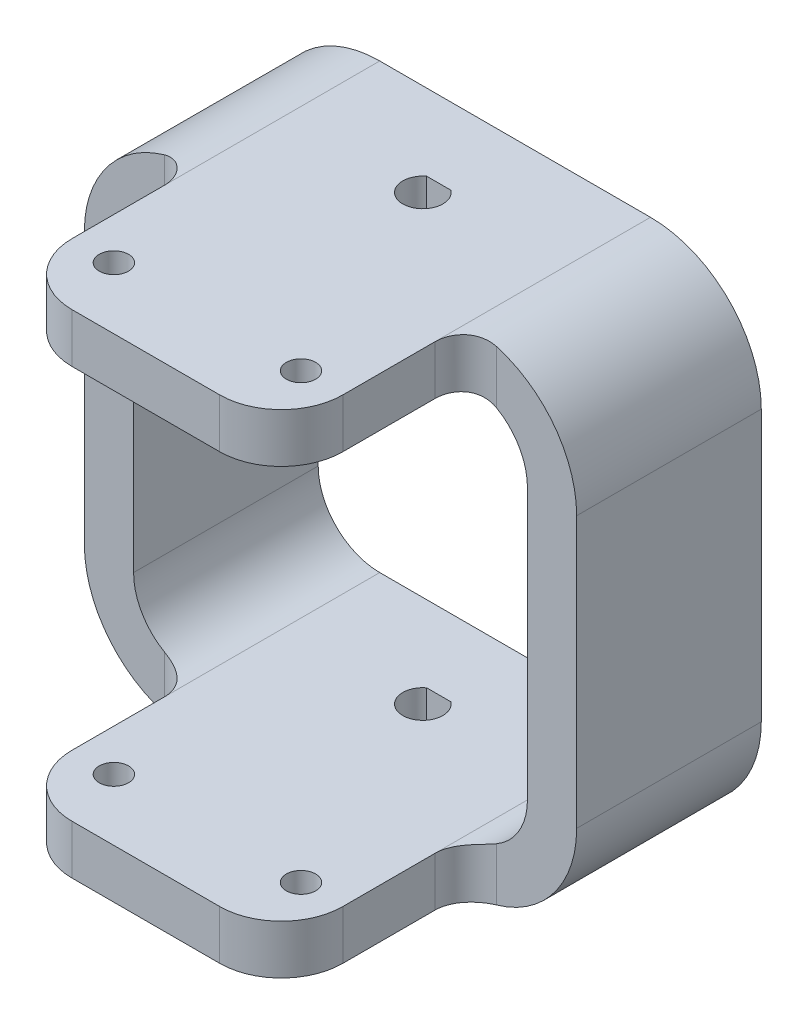
from build123d import *

# Parameters (mm, degrees)
ESQUISSE1_W                             = 80
ESQUISSE1_H                             = 80
ESQUISSE1_W_2                           = 64
ESQUISSE1_H_2                           = 64
BOSS_EXTRU_1_DEPTH                      = 15
CONG_2_R                                = 18
CONG_3_R                                = 10
ESQUISSE7_W                             = 44
ESQUISSE7_H                             = 8
BOSS_EXTRU_4_DEPTH                      = 30
PER_AGE_POUR_CROUS_AUTO_BLOQUANTS_300_D = 4.7625
CONG_1_R                                = 10
CONG_1_OF_SYM_TRIE2_R                   = 10
CONG_4_R                                = 5
ENL_V_MAT_EXTRU_3_DEPTH                 = 124.38962689


with BuildPart() as part:
    # Esquisse1 → Boss.-Extru.1 (new, symmetric)
    with BuildSketch(Plane.XY):
        Rectangle(ESQUISSE1_W, ESQUISSE1_H)
        Rectangle(ESQUISSE1_W_2, ESQUISSE1_H_2, mode=Mode.SUBTRACT)
    extrude(amount=BOSS_EXTRU_1_DEPTH, both=True)

    # Congé2
    cong_2_edges = [part.edges().sort_by_distance(p)[0] for p in [
        (-40, 40, 0),
        (40, 40, 0),
        (40, -40, 0),
        (-40, -40, 0),
    ]]
    fillet(cong_2_edges, radius=CONG_2_R)

    # Congé3
    cong_3_edges = [part.edges().sort_by_distance(p)[0] for p in [
        (32, -32, 0),
        (32, 32, 0),
        (-32, 32, 0),
        (-32, -32, 0),
    ]]
    fillet(cong_3_edges, radius=CONG_3_R)

    # Esquisse7 → Boss.-Extru.4 (add)
    with BuildSketch(Plane.XY.offset(15)):
        with Locations((0, 36)):
            Rectangle(ESQUISSE7_W, ESQUISSE7_H)
    boss_extru_4 = extrude(amount=BOSS_EXTRU_4_DEPTH)

    # Perçage pour écrous auto-bloquants 300® #6 (SP)1 (through all)
    with Locations(Plane(origin=(0, 40, 0), x_dir=(0, 0, -1), z_dir=(0, 1, 0))):
        with Locations((-35, -15.205), (-35, 15.205)):
            per_age_pour_crous_auto_bloquants_300 = Hole(PER_AGE_POUR_CROUS_AUTO_BLOQUANTS_300_D / 2)

    # Congé1
    cong_1_edges = [part.edges().sort_by_distance(p)[0] for p in [
        (22, 36, 45),
        (-22, 36, 45),
    ]]
    fillet(cong_1_edges, radius=CONG_1_R)

    # Symétrie2: Boss.-Extru.4, Perçage pour écrous auto-bloquants 300® #6 (SP)1 across plane
    add(boss_extru_4.mirror(Plane.ZX))
    add(per_age_pour_crous_auto_bloquants_300.mirror(Plane.ZX), mode=Mode.SUBTRACT)

    # Congé1 of Symétrie2
    cong_1_of_sym_trie2_edges = [part.edges().sort_by_distance(p)[0] for p in [
        (22, -36, 45),
        (-22, -36, 45),
    ]]
    fillet(cong_1_of_sym_trie2_edges, radius=CONG_1_OF_SYM_TRIE2_R)

    # Congé4
    # the kernel refuses this fillet: 5 mm, written as the material it adds along each edge
    with BuildSketch(Plane(origin=(22, -52.5, 15), x_dir=(0, 0, 1), z_dir=(0, 1, 0))) as cong_4_piece_1_section:
        with BuildLine():
            CenterArc((CONG_4_R, CONG_4_R), CONG_4_R, 180, 90)
            Line((0, CONG_4_R), (0, 0))
            Line((0, 0), (CONG_4_R, 0))
        make_face()
    cong_4_piece_1 = extrude(amount=33, mode=Mode.PRIVATE)
    cong_4_piece_1 = cong_4_piece_1 - Plane(origin=(22, -22, 16.121951886), x_dir=(0, -1, 0), z_dir=(0, 0, -1)) * Cylinder(10, 86, mode=Mode.PRIVATE)
    cong_4_piece_1 = cong_4_piece_1 & Plane(origin=(22, -22, 16.121951886), x_dir=(0, -1, 0), z_dir=(0, 0, 1)) * Cylinder(18, 86, mode=Mode.PRIVATE)
    add(cong_4_piece_1)
    with BuildSketch(Plane(origin=(-22, -19.5, 15), x_dir=(0, 0, 1), z_dir=(0, -1, 0))) as cong_4_piece_2_section:
        with BuildLine():
            CenterArc((CONG_4_R, CONG_4_R), CONG_4_R, 180, 90)
            Line((0, CONG_4_R), (0, 0))
            Line((0, 0), (CONG_4_R, 0))
        make_face()
    cong_4_piece_2 = extrude(amount=33, mode=Mode.PRIVATE)
    cong_4_piece_2 = cong_4_piece_2 - Plane(origin=(-22, -22, 15.430791952), x_dir=(0, -1, 0), z_dir=(0, 0, 1)) * Cylinder(10, 87, mode=Mode.PRIVATE)
    cong_4_piece_2 = cong_4_piece_2 & Plane(origin=(-22, -22, 15.430791952), x_dir=(0, -1, 0), z_dir=(0, 0, -1)) * Cylinder(18, 87, mode=Mode.PRIVATE)
    add(cong_4_piece_2)
    with BuildSketch(Plane(origin=(22, 52.5, 15), x_dir=(1, 0, 0), z_dir=(0, -1, 0))) as cong_4_piece_3_section:
        with BuildLine():
            CenterArc((CONG_4_R, CONG_4_R), CONG_4_R, 180, 90)
            Line((0, CONG_4_R), (0, 0))
            Line((0, 0), (CONG_4_R, 0))
        make_face()
    cong_4_piece_3 = extrude(amount=33, mode=Mode.PRIVATE)
    cong_4_piece_3 = cong_4_piece_3 - Plane(origin=(22, 22, 16.121951469), x_dir=(1, 0, 0), z_dir=(0, 0, -1)) * Cylinder(10, 86, mode=Mode.PRIVATE)
    cong_4_piece_3 = cong_4_piece_3 & Plane(origin=(22, 22, 16.121951469), x_dir=(0, 1, 0), z_dir=(0, 0, 1)) * Cylinder(18, 86, mode=Mode.PRIVATE)
    add(cong_4_piece_3)
    with BuildSketch(Plane(origin=(-22, 19.5, 15), x_dir=(-1, 0, 0), z_dir=(0, 1, 0))) as cong_4_piece_4_section:
        with BuildLine():
            CenterArc((CONG_4_R, CONG_4_R), CONG_4_R, 180, 90)
            Line((0, CONG_4_R), (0, 0))
            Line((0, 0), (CONG_4_R, 0))
        make_face()
    cong_4_piece_4 = extrude(amount=33, mode=Mode.PRIVATE)
    cong_4_piece_4 = cong_4_piece_4 - Plane(origin=(-22, 22, 15.430738001), x_dir=(0, 1, 0), z_dir=(0, 0, -1)) * Cylinder(10, 87, mode=Mode.PRIVATE)
    cong_4_piece_4 = cong_4_piece_4 & Plane(origin=(-22, 22, 15.430738001), x_dir=(0, 1, 0), z_dir=(0, 0, -1)) * Cylinder(18, 87, mode=Mode.PRIVATE)
    add(cong_4_piece_4)

    # Esquisse11 → Enlèv. mat.-Extru.3 (cut, through all)
    with BuildSketch(Plane(origin=(0, -40, -40), x_dir=(1, 0, 0), z_dir=(0, 1, 0))):
        with BuildLine():
            Line((1.964942747, -37.405), (-1.964942747, -37.405))
            ThreePointArc((-1.964942747, -37.405), (0, -43.255), (1.964942747, -37.405))
        make_face()
    extrude(amount=ENL_V_MAT_EXTRU_3_DEPTH, mode=Mode.SUBTRACT)


solid = part.part
